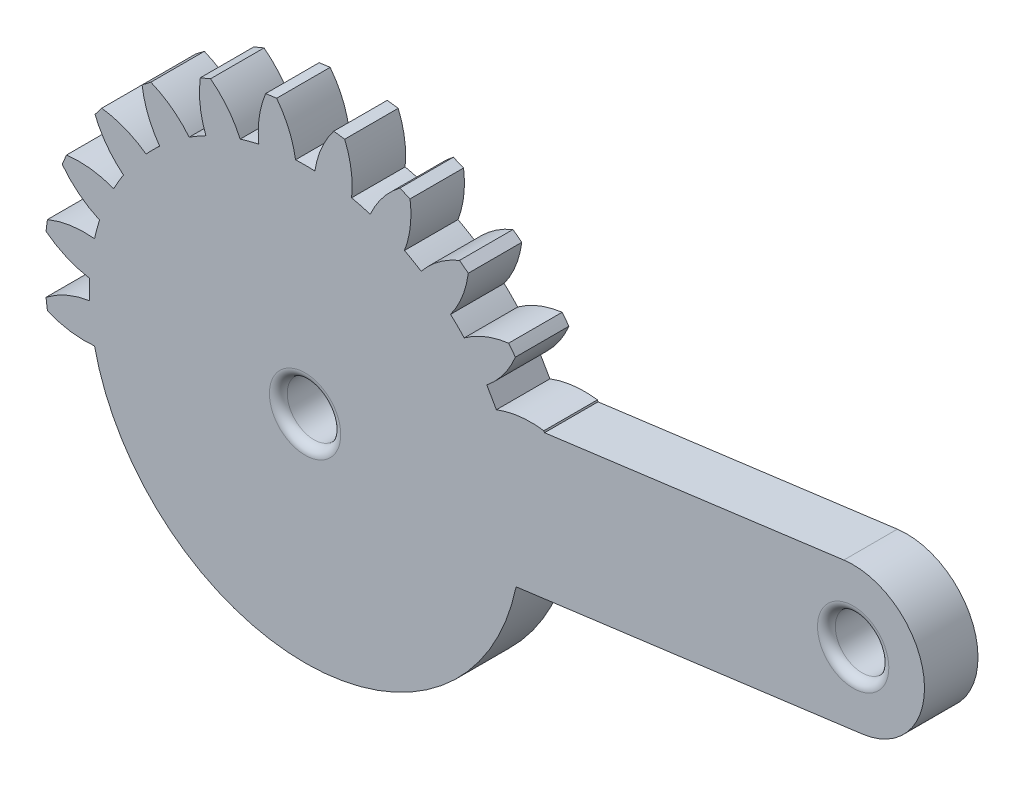
from build123d import *

# Parameters (mm, degrees)
BOSS_EXTRUDE1_START     = -3
BOSS_EXTRUDE1_OUTLINE_R = 1.5
BOSS_EXTRUDE1_DEPTH     = 3
FILLET1_R               = 0.5


# Read off the part's stored shape, not the designer's step: Boss-Extrude1
with BuildPart() as part:
    # Boss-Extrude1 outline → Boss-Extrude1 (new body)
    with BuildSketch(Plane.XY.offset(BOSS_EXTRUDE1_START)):
        with BuildLine():
            Line((11.834428484, -2.472731782), (31.256409707, 0.084220555))
            ThreePointArc((31.256409707, 0.084220555), (34.700084383, 4.572104769), (30.212200169, 8.015779445))
            Line((30.212200169, 8.015779445), (13.428337838, 5.806142051))
            ThreePointArc((13.428337838, 5.806142051), (13.411032377, 5.846003182), (13.39360859, 5.885812734))
            ThreePointArc((13.39360859, 5.885812734), (12.04167814, 5.897146383), (10.729304164, 5.572309592))
            Line((10.729304164, 5.572309592), (10.189200244, 6.507557022))
            ThreePointArc((10.189200244, 6.507557022), (11.126720661, 7.481723913), (11.792869471, 8.658240563))
            ThreePointArc((11.792869471, 8.658240563), (11.606759368, 8.906179706), (11.415437385, 9.150119633))
            ThreePointArc((11.415437385, 9.150119633), (10.106597569, 8.81117421), (8.922976471, 8.15773197))
            ThreePointArc((8.922976471, 8.15773197), (8.549706323, 8.548135574), (8.159371308, 8.921477448))
            ThreePointArc((8.159371308, 8.921477448), (8.812813548, 10.105098546), (9.151758972, 11.413938362))
            Line((9.151758972, 11.413938362), (8.659879901, 11.791370448))
            ThreePointArc((8.659879901, 11.791370448), (7.483516811, 11.125336137), (6.509436976, 10.187999326))
            ThreePointArc((6.509436976, 10.187999326), (6.047829045, 10.468613272), (5.574146563, 10.728326528))
            ThreePointArc((5.574146563, 10.728326528), (5.898805358, 12.040487702), (5.887415057, 13.392168338))
            Line((5.887415057, 13.392168338), (5.314609747, 13.629432066))
            ThreePointArc((5.314609747, 13.629432066), (4.351003751, 12.681995862), (3.65280527, 11.524977816))
            ThreePointArc((3.65280527, 11.524977816), (3.134170467, 11.676689406), (2.609274564, 11.805074597))
            ThreePointArc((2.609274564, 11.805074597), (2.58305967, 13.15599481), (2.222297371, 14.458117388))
            Line((2.222297371, 14.458117388), (1.607601557, 14.539043627))
            ThreePointArc((1.607601557, 14.539043627), (0.922327421, 13.375148622), (0.547316802, 12.077605074))
            ThreePointArc((0.547316802, 12.077605074), (0.006856042, 12.089998056), (-0.533618427, 12.078218055))
            ThreePointArc((-0.533618427, 12.078218055), (-0.908651119, 13.375486662), (-1.593822374, 14.539142845))
            Line((-1.593822374, 14.539142845), (-2.208518188, 14.458216606))
            ThreePointArc((-2.208518188, 14.458216606), (-2.569071942, 13.157522433), (-2.595800172, 11.808044777))
            ThreePointArc((-2.595800172, 11.808044777), (-3.121351418, 11.680122659), (-3.640655008, 11.528821757))
            ThreePointArc((-3.640655008, 11.528821757), (-4.338480819, 12.683812024), (-5.300881923, 13.629722958))
            Line((-5.300881923, 13.629722958), (-5.873687233, 13.39245923))
            ThreePointArc((-5.873687233, 13.39245923), (-5.885433032, 12.043808909), (-5.562611018, 10.734312212))
            ThreePointArc((-5.562611018, 10.734312212), (-6.037455135, 10.474599539), (-6.500199913, 10.193895285))
            ThreePointArc((-6.500199913, 10.193895285), (-7.47268922, 11.127885908), (-8.646251294, 11.791833189))
            Line((-8.646251294, 11.791833189), (-9.138130365, 11.414401103))
            ThreePointArc((-9.138130365, 11.414401103), (-8.80083054, 10.109699304), (-8.150983569, 8.92914144))
            ThreePointArc((-8.150983569, 8.92914144), (-8.542690029, 8.555147402), (-8.917254459, 8.163986338))
            ThreePointArc((-8.917254459, 8.163986338), (-10.097571821, 8.813551755), (-11.401949093, 9.15072269))
            Line((-11.401949093, 9.15072269), (-11.779381179, 8.658843619))
            ThreePointArc((-11.779381179, 8.658843619), (-11.116550367, 7.486781519), (-10.184349411, 6.515145975))
            ThreePointArc((-10.184349411, 6.515145975), (-10.46607819, 6.052215075), (-10.726778871, 5.577124264))
            ThreePointArc((-10.726778871, 5.577124264), (-12.034053776, 5.89841947), (-13.38017907, 5.886378776))
            Line((-13.38017907, 5.886378776), (-13.617442798, 5.313573465))
            ThreePointArc((-13.617442798, 5.313573465), (-12.674640857, 4.353631081), (-11.523783462, 3.656571444))
            ThreePointArc((-11.523783462, 3.656571444), (-11.67614775, 3.13618777), (-11.805025713, 2.60949572))
            ThreePointArc((-11.805025713, 2.60949572), (-13.149945407, 2.581153618), (-14.44612812, 2.221261089))
            Line((-14.44612812, 2.221261089), (-14.527054359, 1.606565275))
            ThreePointArc((-14.527054359, 1.606565275), (-13.368714152, 0.923687604), (-12.07756623, 0.548173302))
            ThreePointArc((-12.07756623, 0.548173302), (-12.089998597, 0.005825389), (-12.07808888, -0.536534252))
            ThreePointArc((-12.07808888, -0.536534252), (-13.369010177, -0.912066026), (-14.527153576, -1.594858655))
            Line((-14.527153576, -1.594858655), (-14.446227337, -2.20955447))
            ThreePointArc((-14.446227337, -2.20955447), (-13.151251636, -2.569269431), (-11.807551859, -2.598041398))
            ThreePointArc((-11.807551859, -2.598041398), (0.064079741, -12.08983018), (11.834428484, -2.472731782))
        make_face()
        Circle(BOSS_EXTRUDE1_OUTLINE_R, mode=Mode.SUBTRACT)
        with Locations((30.734304938, 4.05)):
            Circle(BOSS_EXTRUDE1_OUTLINE_R, mode=Mode.SUBTRACT)
    extrude(amount=BOSS_EXTRUDE1_DEPTH)

    # Fillet1
    fillet1_edges = [part.edges().sort_by_distance(p)[0] for p in [
        (29.234304938, 4.05, -3),
        (29.234304938, 4.05, 0),
        (-1.5, 0, 0),
        (-1.5, 0, -3),
    ]]
    fillet(fillet1_edges, radius=FILLET1_R)


solid = part.part
